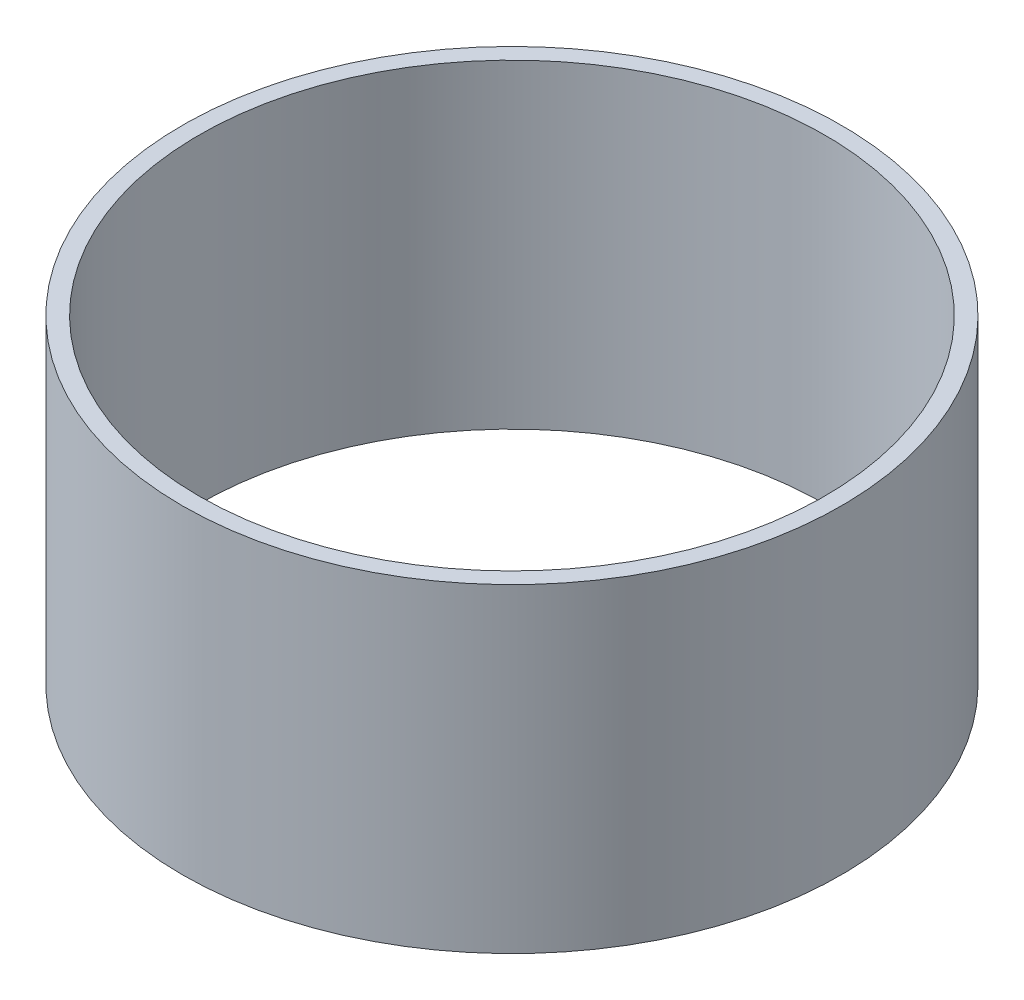
from build123d import *

# Parameters (mm, degrees)
SKETCH1_R           = 93.6625
SKETCH1_R_2         = 88.9
BOSS_EXTRUDE1_DEPTH = 45.40758


with BuildPart() as part:
    # Sketch1 → Boss-Extrude1 (new, symmetric)
    with BuildSketch(Plane(origin=(0, 0, 0), x_dir=(1, 0, 0), z_dir=(0, 1, 0))):
        Circle(SKETCH1_R)
        Circle(SKETCH1_R_2, mode=Mode.SUBTRACT)
    extrude(amount=BOSS_EXTRUDE1_DEPTH, both=True)


solid = part.part
